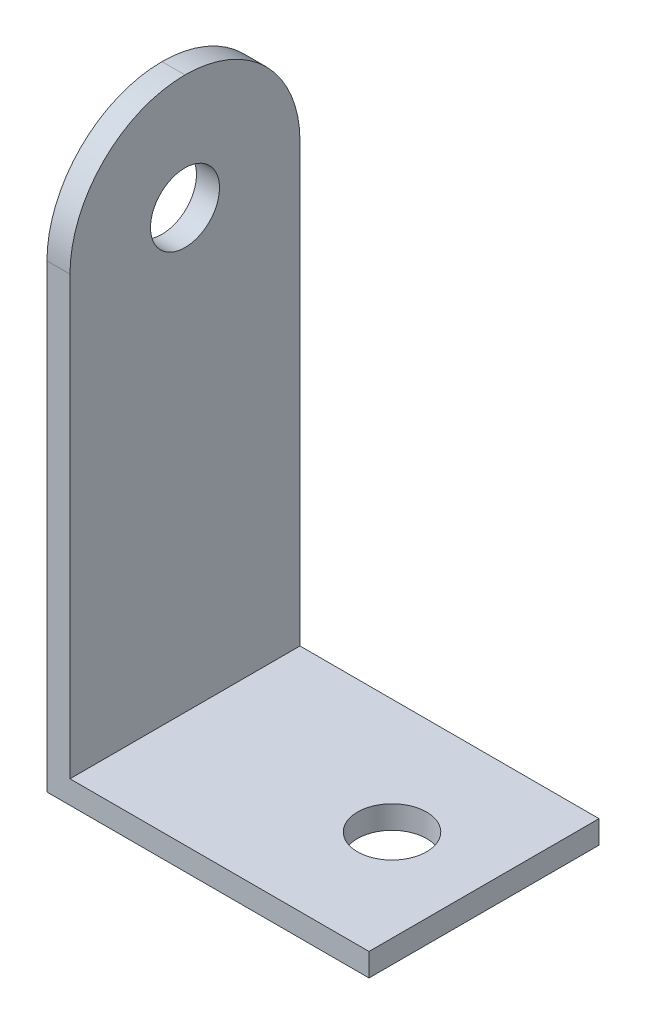
from build123d import *

# Parameters (mm, degrees)
BOSS_EXTRUDE1_DEPTH = 10
FILLET1_R           = 5
SKETCH2_R           = 1.5
CUT_EXTRUDE1_DEPTH  = 30.899832775
SKETCH3_R           = 1.5
CUT_EXTRUDE2_DEPTH  = 30.52964612


with BuildPart() as part:
    # Sketch1 → Boss-Extrude1 (new body)
    with BuildSketch(Plane.XY):
        Polygon((0, 0), (0, 25), (1, 25), (1, 1), (14, 1), (14, 0), align=None)
    extrude(amount=BOSS_EXTRUDE1_DEPTH)

    # Fillet1
    fillet1_edges = [part.edges().sort_by_distance(p)[0] for p in [
        (0.5, 25, 0),
        (0.5, 25, 10),
    ]]
    fillet(fillet1_edges, radius=FILLET1_R - 0.0001)  # a hair under: the kernel refuses the full size

    # Sketch2 → Cut-Extrude1 (cut, through all)
    with BuildSketch(Plane(origin=(1, 0, 0), x_dir=(0, 0, -1), z_dir=(1, 0, 0))):
        with Locations(Location((-5, 20, 0), (0, 0, 90))):
            Circle(SKETCH2_R)
    extrude(amount=-CUT_EXTRUDE1_DEPTH, mode=Mode.SUBTRACT)

    # Sketch3 → Cut-Extrude2 (cut, through all)
    with BuildSketch(Plane(origin=(0, 1, 0), x_dir=(1, 0, 0), z_dir=(0, 1, 0))):
        with Locations(Location((10, -5, 0), (0, 0, 180))):
            Circle(SKETCH3_R)
    extrude(amount=-CUT_EXTRUDE2_DEPTH, mode=Mode.SUBTRACT)


solid = part.part
